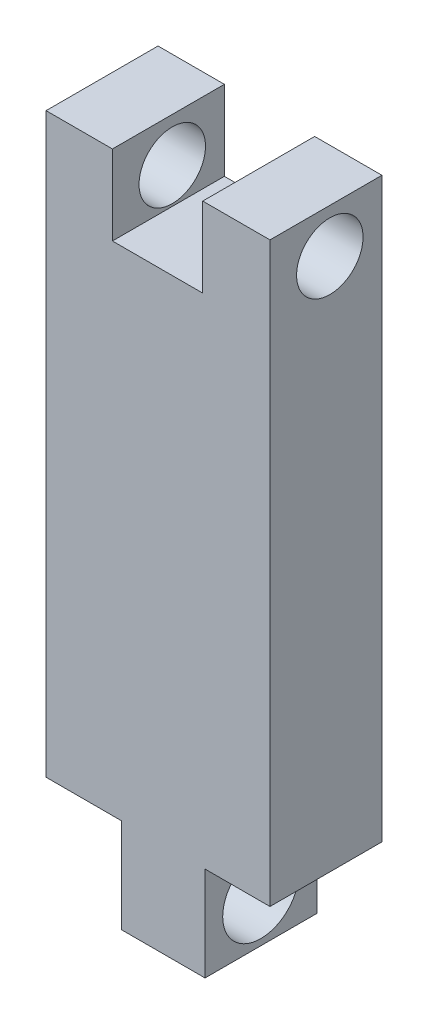
from build123d import *

# Parameters (mm, degrees)
SKETCH1_W           = 25.4
SKETCH1_H           = 76.2
BOSS_EXTRUDE1_DEPTH = 12.7
SKETCH5_W           = 10.243245385
SKETCH5_H           = 9.04366532
CUT_EXTRUDE1_DEPTH  = 82.319677815
SKETCH6_R           = 3.771869263
CUT_EXTRUDE2_DEPTH  = 82.319677815
SKETCH7_W           = 8.543026749
SKETCH7_H           = 10.704816767
SKETCH7_W_2         = 7.365552698
CUT_EXTRUDE3_DEPTH  = 82.319677815
SKETCH8_R           = 4.318572557
CUT_EXTRUDE4_DEPTH  = 80.0688785


with BuildPart() as part:
    # Sketch1 → Boss-Extrude1 (new body)
    with BuildSketch(Plane.XY):
        with Locations((12.7, 38.1)):
            Rectangle(SKETCH1_W, SKETCH1_H)
    extrude(amount=BOSS_EXTRUDE1_DEPTH)

    # Sketch5 → Cut-Extrude1 (cut, through all)
    with BuildSketch(Plane.XY.offset(12.7)):
        with Locations((12.649290864, 71.67816734)):
            Rectangle(SKETCH5_W, SKETCH5_H)
    extrude(amount=-CUT_EXTRUDE1_DEPTH, mode=Mode.SUBTRACT)

    # Sketch6 → Cut-Extrude2 (cut, through all)
    with BuildSketch(Plane.ZY):
        with Locations((5.909884629, 71.204061757)):
            Circle(SKETCH6_R)
    extrude(amount=-CUT_EXTRUDE2_DEPTH, mode=Mode.SUBTRACT)

    # Sketch7 → Cut-Extrude3 (cut, through all)
    with BuildSketch(Plane.XY.offset(12.7)):
        with Locations((4.271513375, 5.352408384)):
            Rectangle(SKETCH7_W, SKETCH7_H)
        with Locations((21.717223651, 5.352408384)):
            Rectangle(SKETCH7_W_2, SKETCH7_H)
    extrude(amount=-CUT_EXTRUDE3_DEPTH, mode=Mode.SUBTRACT)

    # Sketch8 → Cut-Extrude4 (cut, through all)
    with BuildSketch(Plane.ZY.offset(-8.543026749)):
        with Locations((6.380219193, 5.025355447)):
            Circle(SKETCH8_R)
    extrude(amount=-CUT_EXTRUDE4_DEPTH, mode=Mode.SUBTRACT)


solid = part.part
